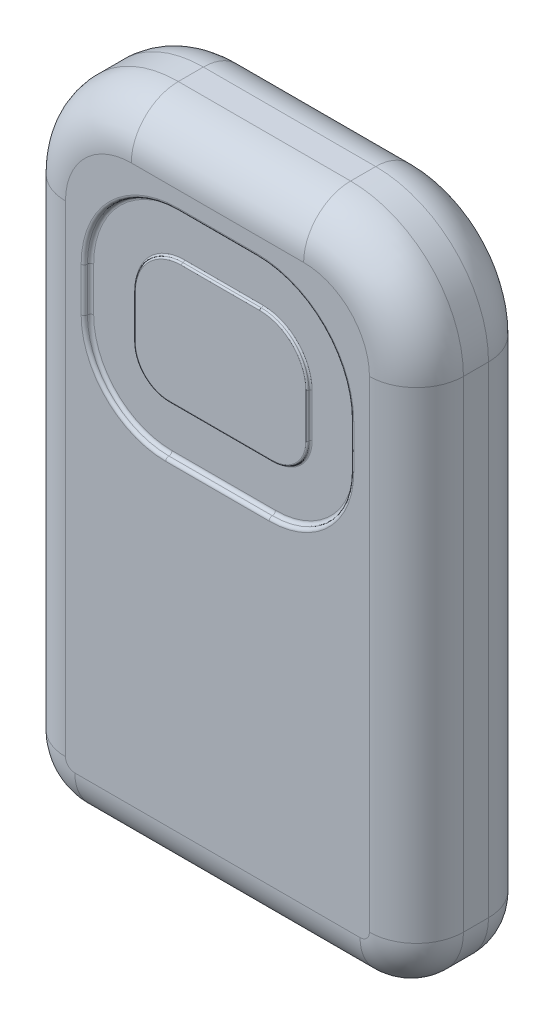
from build123d import *

# Parameters (mm, degrees)
BOSS_EXTRUDE1_DEPTH = 24.13
FILLET3_R           = 9.525
CUT_EXTRUDE1_DEPTH  = 1.27
BOSS_EXTRUDE3_START = 22.86
BOSS_EXTRUDE3_DEPTH = 0.635
FILLET4_R           = 0.635
BOSS_EXTRUDE2_DEPTH = 0.635
FILLET6_R           = 0.3175


# Read off the part's stored shape, not the designer's step: Boss-Extrude3
with BuildPart() as part:
    # Sketch1 → Boss-Extrude1 (new body)
    with BuildSketch(Plane.XY):
        with BuildLine():
            Line((10.668, -1.16760682), (68.453, -1.16760682))
            ThreePointArc((68.453, -1.16760682), (76.535230509, 2.180162671), (79.883, 10.26239318))
            Line((79.883, 10.26239318), (79.883, 107.79839318))
            ThreePointArc((79.883, 107.79839318), (73.187461018, 123.962854198), (57.023, 130.65839318))
            Line((57.023, 130.65839318), (22.098, 130.65839318))
            ThreePointArc((22.098, 130.65839318), (5.933538982, 123.962854198), (-0.762, 107.79839318))
            Line((-0.762, 107.79839318), (-0.762, 10.26239318))
            ThreePointArc((-0.762, 10.26239318), (2.585769491, 2.180162671), (10.668, -1.16760682))
        make_face()
    extrude(amount=BOSS_EXTRUDE1_DEPTH)

    # Fillet3
    fillet3_edges = [part.edges().sort_by_distance(p)[0] for p in [
        (5.933538982, 123.962854198, 24.13),
        (39.5605, 130.65839318, 0),
        (73.187461018, 123.962854198, 0),
        (-0.762, 59.03039318, 24.13),
        (2.585769491, 2.180162671, 24.13),
        (39.5605, -1.16760682, 24.13),
        (76.535230509, 2.180162671, 24.13),
        (79.883, 59.03039318, 24.13),
        (73.187461018, 123.962854198, 24.13),
        (39.5605, 130.65839318, 24.13),
        (79.883, 59.03039318, 0),
        (76.535230509, 2.180162671, 0),
        (39.5605, -1.16760682, 0),
        (2.585769491, 2.180162671, 0),
        (-0.762, 59.03039318, 0),
        (5.933538982, 123.962854198, 0),
    ]]
    fillet(fillet3_edges, radius=FILLET3_R)

    # Sketch3 → Cut-Extrude1 (cut)
    with BuildSketch(Plane.XY.offset(24.13)):
        with BuildLine():
            Line((12.573, 98.27339318), (12.573, 89.38339318))
            ThreePointArc((12.573, 89.38339318), (17.408667043, 77.709060222), (29.083, 72.87339318))
            Line((29.083, 72.87339318), (50.038, 72.87339318))
            ThreePointArc((50.038, 72.87339318), (61.712332957, 77.709060222), (66.548, 89.38339318))
            Line((66.548, 89.38339318), (66.548, 98.27339318))
            ThreePointArc((66.548, 98.27339318), (60.968384182, 111.743777361), (47.498, 117.32339318))
            Line((47.498, 117.32339318), (31.623, 117.32339318))
            ThreePointArc((31.623, 117.32339318), (18.152615818, 111.743777361), (12.573, 98.27339318))
        make_face()
    extrude(amount=-CUT_EXTRUDE1_DEPTH, mode=Mode.SUBTRACT)

    # Boss-Extrude3 outline → Boss-Extrude3 (add)
    with BuildSketch(Plane.XY.offset(BOSS_EXTRUDE3_START)):
        with BuildLine():
            ThreePointArc((21.971, 89.38339318), (24.054056572, 84.354449752), (29.083, 82.27139318))
            Line((29.083, 82.27139318), (50.038, 82.27139318))
            ThreePointArc((50.038, 82.27139318), (55.066943428, 84.354449752), (57.15, 89.38339318))
            Line((57.15, 89.38339318), (57.15, 98.27339318))
            ThreePointArc((57.15, 98.27339318), (54.322994652, 105.098387832), (47.498, 107.92539318))
            Line((47.498, 107.92539318), (31.623, 107.92539318))
            ThreePointArc((31.623, 107.92539318), (24.798005348, 105.098387832), (21.971, 98.27339318))
            Line((21.971, 98.27339318), (21.971, 89.38339318))
        make_face()
    extrude(amount=BOSS_EXTRUDE3_DEPTH)

    # Fillet4
    fillet4_edges = [part.edges().sort_by_distance(p)[0] for p in [
        (18.152615818, 111.743777361, 22.86),
        (12.573, 93.82839318, 22.86),
        (17.408667043, 77.709060222, 22.86),
        (39.5605, 72.87339318, 22.86),
        (61.712332957, 77.709060222, 22.86),
        (66.548, 93.82839318, 22.86),
        (60.968384182, 111.743777361, 22.86),
        (39.5605, 117.32339318, 24.13),
        (60.968384182, 111.743777361, 24.13),
        (66.548, 93.82839318, 24.13),
        (61.712332957, 77.709060222, 24.13),
        (39.5605, 72.87339318, 24.13),
        (17.408667043, 77.709060222, 24.13),
        (12.573, 93.82839318, 24.13),
        (39.5605, 117.32339318, 22.86),
        (18.152615818, 111.743777361, 24.13),
    ]]
    fillet(fillet4_edges, radius=FILLET4_R - 0.0001)  # a hair under: the kernel refuses the full size

    # Sketch4 → Boss-Extrude2 (add)
    with BuildSketch(Plane.XY.offset(22.86)):
        with BuildLine():
            Line((57.15, 89.38339318), (57.15, 98.27339318))
            ThreePointArc((57.15, 98.27339318), (54.322994652, 105.098387832), (47.498, 107.92539318))
            Line((47.498, 107.92539318), (31.623, 107.92539318))
            ThreePointArc((31.623, 107.92539318), (24.798005348, 105.098387832), (21.971, 98.27339318))
            Line((21.971, 98.27339318), (21.971, 89.38339318))
            ThreePointArc((21.971, 89.38339318), (24.054056572, 84.354449752), (29.083, 82.27139318))
            Line((29.083, 82.27139318), (50.038, 82.27139318))
            ThreePointArc((50.038, 82.27139318), (55.066943428, 84.354449752), (57.15, 89.38339318))
        make_face()
    extrude(amount=BOSS_EXTRUDE2_DEPTH)

    # Fillet6
    fillet6_edges = [part.edges().sort_by_distance(p)[0] for p in [
        (24.798005348, 105.098387832, 22.86),
        (21.971, 93.82839318, 22.86),
        (24.054056572, 84.354449752, 22.86),
        (39.5605, 82.27139318, 22.86),
        (55.066943428, 84.354449752, 22.86),
        (57.15, 93.82839318, 22.86),
        (54.322994652, 105.098387832, 22.86),
        (21.971, 93.82839318, 23.495),
        (24.798005348, 105.098387832, 23.495),
        (39.5605, 107.92539318, 23.495),
        (54.322994652, 105.098387832, 23.495),
        (57.15, 93.82839318, 23.495),
        (55.066943428, 84.354449752, 23.495),
        (39.5605, 82.27139318, 23.495),
        (24.054056572, 84.354449752, 23.495),
        (39.5605, 107.92539318, 22.86),
    ]]
    fillet(fillet6_edges, radius=FILLET6_R - 0.0001)  # a hair under: the kernel refuses the full size


solid = part.part
